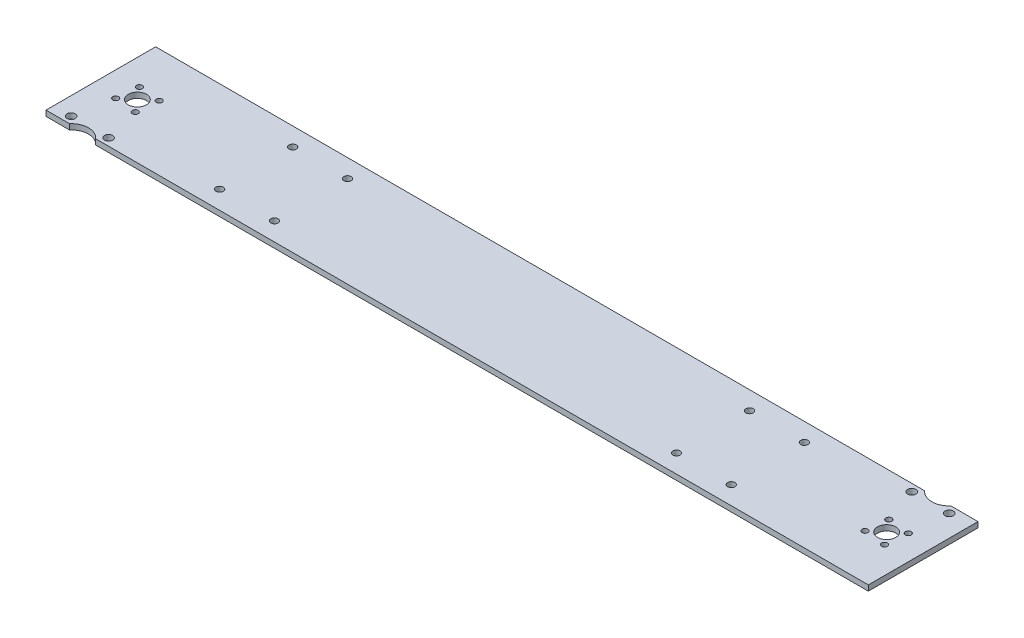
from build123d import *

# Parameters (mm, degrees)
SZKIC1_W                    = 450
SZKIC1_H                    = 60
DODANIE_WYCI_GNI_CIE1_DEPTH = 3
OTW_R_POD_RUB_M41_D         = 4
SZKIC8_R                    = 5
WYTNIJ_WYCI_GNI_CIE1_DEPTH  = 10
SZKIC9_R                    = 1.6
WYTNIJ_WYCI_GNI_CIE2_DEPTH  = 454.992290683
SZKIC10_R                   = 1.6
WYTNIJ_WYCI_GNI_CIE3_DEPTH  = 10
SKETCH1_R                   = 9.5
SKETCH1_R_2                 = 2.25
CUT_EXTRUDE1_DEPTH          = 454.992290683


with BuildPart() as part:
    # Szkic1 → Dodanie-wyciągnięcie1 (new body)
    with BuildSketch(Plane(origin=(0, 0, 0), x_dir=(1, 0, 0), z_dir=(0, 1, 0))):
        with Locations((-225, 30)):
            Rectangle(SZKIC1_W, SZKIC1_H)
    extrude(amount=DODANIE_WYCI_GNI_CIE1_DEPTH)

    # Otwór pod śrubę M41 (through all)
    with Locations(Plane(origin=(0, 3, 0), x_dir=(1, 0, 0), z_dir=(0, 1, 0))):
        with Locations((-365, 50), (-335, 50), (-365, 10), (-335, 10), (-115, 50), (-85, 50), (-115, 10), (-85, 10)):
            Hole(OTW_R_POD_RUB_M41_D / 2)

    # Szkic8 → Wytnij-wyciągnięcie1 (cut)
    with BuildSketch(Plane(origin=(0, 3, 0), x_dir=(1, 0, 0), z_dir=(0, 1, 0))):
        with Locations((-20, 30)):
            Circle(SZKIC8_R)
        with Locations((-430, 30)):
            Circle(SZKIC8_R)
    extrude(amount=-WYTNIJ_WYCI_GNI_CIE1_DEPTH, mode=Mode.SUBTRACT)

    # Szkic9 → Wytnij-wyciągnięcie2 (cut, through all)
    with BuildSketch(Plane(origin=(0, 3, 0), x_dir=(1, 0, 0), z_dir=(0, 1, 0))):
        with Locations((-435.356336542, 36.510917908)):
            Circle(SZKIC9_R)
        with Locations((-436.510917908, 24.643663458)):
            Circle(SZKIC9_R)
        with Locations((-424.643663458, 23.489082092)):
            Circle(SZKIC9_R)
        with Locations((-423.489082092, 35.356336542)):
            Circle(SZKIC9_R)
    extrude(amount=-WYTNIJ_WYCI_GNI_CIE2_DEPTH, mode=Mode.SUBTRACT)

    # Szkic10 → Wytnij-wyciągnięcie3 (cut)
    with BuildSketch(Plane(origin=(0, 3, 0), x_dir=(1, 0, 0), z_dir=(0, 1, 0))):
        with Locations((-13.489082092, 35.356336542)):
            Circle(SZKIC10_R)
        with Locations((-14.643663458, 23.489082092)):
            Circle(SZKIC10_R)
        with Locations((-26.510917908, 24.643663458)):
            Circle(SZKIC10_R)
        with Locations((-25.345722644, 36.554977749)):
            Circle(SZKIC10_R)
    extrude(amount=-WYTNIJ_WYCI_GNI_CIE3_DEPTH, mode=Mode.SUBTRACT)

    # Sketch1 → Cut-Extrude1 (cut, through all)
    with BuildSketch(Plane(origin=(0, 3, 0), x_dir=(1, 0, 0), z_dir=(0, 1, 0))):
        with Locations((-430, -6.253048327)):
            Circle(SKETCH1_R)
        with Locations((-440.253048327, 4)):
            Circle(SKETCH1_R_2)
        with Locations((-419.746951673, 4)):
            Circle(SKETCH1_R_2)
        with Locations((-11.761566446, 56)):
            Circle(SKETCH1_R_2)
        with Locations((-32.2676631, 56)):
            Circle(SKETCH1_R_2)
        with Locations((-22.014614773, 66.253048327)):
            Circle(SKETCH1_R)
    extrude(amount=-CUT_EXTRUDE1_DEPTH, mode=Mode.SUBTRACT)


solid = part.part
